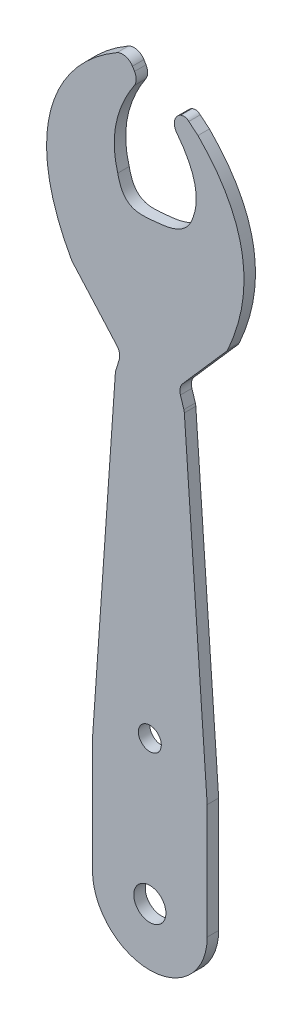
from build123d import *

# Parameters (mm, degrees)
MODEL_R           = 1.4
MODEL_R_2         = 1
BRIDA_BASE1_DEPTH = 1


# Sheet-metal steps are written as plain solids
with BuildPart() as part:
    # Model → Brida base1 (new body)
    with BuildSketch(Plane.XY):
        with BuildLine():
            Line((43.871435578, 46.428949543), (43.688273589, 46.731359657))
            ThreePointArc((43.688273589, 46.731359657), (43.081772243, 47.181843562), (42.333236398, 47.079502368))
            add(Edge.make_bspline(
                [(42.333236398, 47.079502368), (40.764422927, 46.174489073), (35.816548406, 41.900747821), (35.272083644, 35.001949339), (38.359716274, 29.485408266)],
                knots=[0.004002738, 0.004002738, 0.004002738, 0.004002738, 0.255811026, 0.955465838, 0.955465838, 0.955465838, 0.955465838], degree=3))
            ThreePointArc((38.359716274, 29.485408266), (38.416879113, 29.394992141), (38.483372908, 29.311199296))
            Line((38.483372908, 29.311199296), (42.332361737, 24.960661438))
            ThreePointArc((42.332361737, 24.960661438), (42.561250074, 24.507363364), (42.537981803, 24.000088683))
            Line((42.537981803, 24.000088683), (42.240856149, 23.048171958))
            ThreePointArc((42.240856149, 23.048171958), (42.212695742, 22.935208537), (42.197855138, 22.819737764))
            Line((42.197855138, 22.819737764), (40.2059904, -5.7615616))
            Line((40.2059904, -5.7615616), (40.2059904, -15.7615616))
            ThreePointArc((40.2059904, -15.7615616), (45.2059904, -20.7615616), (50.2059904, -15.7615616))
            Line((50.2059904, -15.7615616), (50.2059904, -5.7615616))
            Line((50.2059904, -5.7615616), (48.214125662, 22.819737764))
            ThreePointArc((48.214125662, 22.819737764), (48.199285058, 22.935208537), (48.171124651, 23.048171958))
            Line((48.171124651, 23.048171958), (47.873069238, 24.0030674))
            ThreePointArc((47.873069238, 24.0030674), (47.849307461, 24.508023196), (48.075555852, 24.960081428))
            Line((48.075555852, 24.960081428), (51.860338986, 29.27914154))
            ThreePointArc((51.860338986, 29.27914154), (51.94992334, 29.398217661), (52.020818692, 29.529283781))
            add(Edge.make_bspline(
                [(52.020818692, 29.529283781), (53.24372236, 32.258428286), (54.100570293, 37.543385576), (51.577752865, 42.166423069), (49.399716108, 44.353895199)],
                knots=[0.073238818, 0.073238818, 0.073238818, 0.073238818, 0.521565521, 0.992417875, 0.992417875, 0.992417875, 0.992417875], degree=3))
            Line((49.399716108, 44.353895199), (48.603017078, 45.015390082))
            add(Edge.make_bspline(
                [(48.603017078, 45.015390082), (48.417036758, 45.204787232), (48.174708276, 45.242911079), (47.876031632, 45.129761621)],
                knots=[0, 0, 0, 0, 1, 1, 1, 1], degree=3))
            ThreePointArc((47.876031632, 45.129761621), (47.364904102, 44.467541566), (47.535799978, 43.648651249))
            add(Edge.make_bspline(
                [(47.535799978, 43.648651249), (49.116486798, 41.620539936), (49.633988071, 39.732404237), (48.968154199, 37.939006155)],
                knots=[0, 0, 0, 0, 0.676846712, 0.676846712, 0.676846712, 0.676846712], degree=3))
            add(Edge.make_bspline(
                [(48.968154199, 37.939006155), (48.407530031, 36.24951926), (45.517280844, 35.959596441), (42.879215477, 35.735494746), (42.407543293, 38.017493531)],
                knots=[0, 0, 0, 0, 0.520046034, 1, 1, 1, 1], degree=3))
            add(Edge.make_bspline(
                [(42.407543293, 38.017493531), (42.322809158, 38.308098707), (41.773176484, 40.694157088), (42.398123884, 43.150787581), (43.851661443, 45.361505885)],
                knots=[0.047028419, 0.047028419, 0.047028419, 0.047028419, 0.13151503, 0.738210784, 0.738210784, 0.738210784, 0.738210784], degree=3))
            ThreePointArc((43.851661443, 45.361505885), (44.015919722, 45.892368025), (43.871435578, 46.428949543))
        make_face()
        with Locations((45.2059904, -15.7615616)):
            Circle(MODEL_R, mode=Mode.SUBTRACT)
        with Locations((45.2059904, -3.2615616)):
            Circle(MODEL_R_2, mode=Mode.SUBTRACT)
    extrude(amount=-BRIDA_BASE1_DEPTH)


solid = part.part
